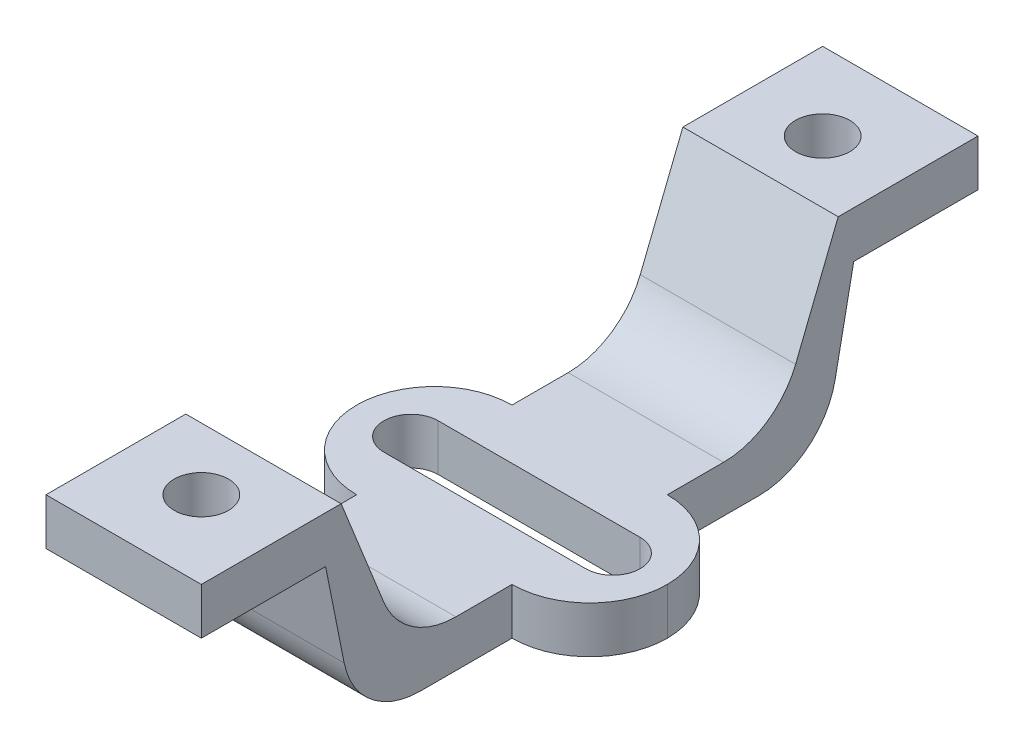
from build123d import *

# Parameters (mm, degrees)
SKETCH_1_W          = 20
SKETCH_1_H          = 10
EXTRUDE_1_DEPTH     = 3
SKETCH_2_W          = 8
SKETCH_2_H          = 3
EXTRUDE_2_DEPTH     = 5
SKETCH_3_R          = 1.75
CUT_EXTRUDE_1_DEPTH = 10
FILLET_1_R          = 5
FILLET_2_R          = 5


with BuildPart() as part:
    # 草图1 → 凸台-拉伸1 (new body)
    with BuildSketch(Plane(origin=(0, 0, 0), x_dir=(1, 0, 0), z_dir=(0, 1, 0))):
        Rectangle(SKETCH_1_W, SKETCH_1_H)
        with BuildLine():
            ThreePointArc((-6.5, -1.75), (-8.25, 0), (-6.5, 1.75))
            Line((-6.5, 1.75), (6.5, 1.75))
            ThreePointArc((6.5, 1.75), (7.737436867, 1.237436867), (8.25, 0))
            ThreePointArc((8.25, 0), (7.737436867, -1.237436867), (6.5, -1.75))
            Line((6.5, -1.75), (-6.5, -1.75))
        make_face(mode=Mode.SUBTRACT)
    extrude(amount=EXTRUDE_1_DEPTH)

    # 草图2 → 凸台-拉伸2 (add, symmetric)
    with BuildSketch(Plane(origin=(0, 0, 0), x_dir=(0, 0, -1), z_dir=(1, 0, 0))):
        with Locations((-21, 11.5)):
            Rectangle(SKETCH_2_W, SKETCH_2_H)
        Polygon((-12, 3), (-5, 3), (-5, 0), (-15, 0), (-17, 10), (-17, 13), (-16, 13), align=None)
        Polygon((16, 13), (17, 13), (17, 10), (15, 0), (5, 0), (5, 3), (12, 3), align=None)
        with Locations((21, 11.5)):
            Rectangle(SKETCH_2_W, SKETCH_2_H)
    extrude(amount=EXTRUDE_2_DEPTH, both=True)

    # 草图3 → 切除-拉伸1 (cut)
    with BuildSketch(Plane(origin=(0, 13, 0), x_dir=(1, 0, 0), z_dir=(0, 1, 0))):
        with Locations(Location((0, 20, 0), (0, 0, 270))):
            Circle(SKETCH_3_R)
        with Locations(Location((0, -20, 0), (0, 0, 270))):
            Circle(SKETCH_3_R)
    extrude(amount=-CUT_EXTRUDE_1_DEPTH, mode=Mode.SUBTRACT)

    # 圆角1
    fillet_1_edges = [part.edges().sort_by_distance(p)[0] for p in [
        (0, 0, 15),
        (0, 3, 12),
        (0, 3, -12),
        (0, 0, -15),
    ]]
    fillet(fillet_1_edges, radius=FILLET_1_R)

    # 圆角2
    fillet_2_edges = [part.edges().sort_by_distance(p)[0] for p in [
        (-10, 1.5, 5),
        (-10, 1.5, -5),
        (10, 1.5, -5),
        (10, 1.5, 5),
    ]]
    fillet(fillet_2_edges, radius=FILLET_2_R - 0.0001)  # a hair under: the kernel refuses the full size


solid = part.part
